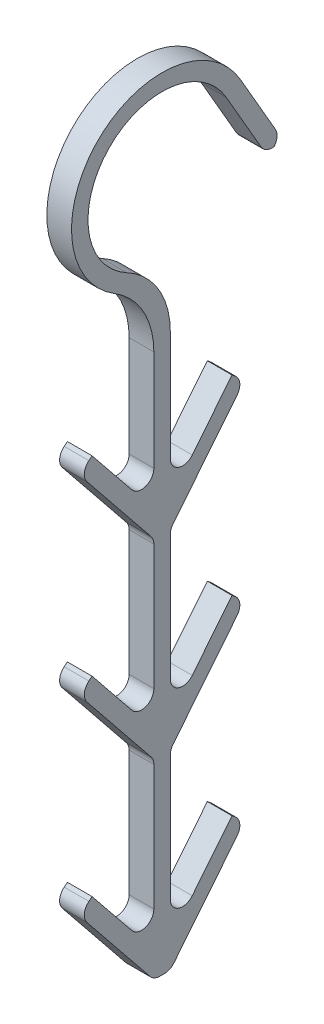
from build123d import *

# Parameters (mm, degrees)
SKETCH1_R           = 22
SKETCH1_R_2         = 18
BOSS_EXTRUDE1_DEPTH = 6
BOSS_EXTRUDE2_DEPTH = 6
CUT_EXTRUDE1_DEPTH  = 37.933063475
SKETCH4_W           = 4
SKETCH4_H           = 30
BOSS_EXTRUDE3_DEPTH = 6
CUT_EXTRUDE2_DEPTH  = 57.332617611
FILLET1_R           = 20
FILLET2_R           = 20
SKETCH6_W           = 4
SKETCH6_H           = 120
BOSS_EXTRUDE4_DEPTH = 6
BOSS_EXTRUDE5_DEPTH = 6
FILLET3_R           = 3


with BuildPart() as part:
    # Sketch1 → Boss-Extrude1 (new body)
    with BuildSketch(Plane(origin=(0, 0, 0), x_dir=(0, 0, -1), z_dir=(1, 0, 0))):
        Circle(SKETCH1_R)
        Circle(SKETCH1_R_2, mode=Mode.SUBTRACT)
    extrude(amount=BOSS_EXTRUDE1_DEPTH)

    # Sketch2 → Boss-Extrude2 (add)
    with BuildSketch(Plane(origin=(6, 0, 0), x_dir=(0, 0, -1), z_dir=(1, 0, 0))):
        Polygon((19.052558883, 11), (29.052558883, -6.320508076), (25.588457268, -8.320508076), (15.588457268, 9), align=None)
    extrude(amount=-BOSS_EXTRUDE2_DEPTH)

    # Sketch3 → Cut-Extrude1 (cut, through all)
    with BuildSketch(Plane(origin=(6, 0, 0), x_dir=(0, 0, -1), z_dir=(1, 0, 0))):
        with BuildLine():
            ThreePointArc((18, 0), (14.280360125, -10.957705722), (4.658742812, -17.386664873))
            Line((4.658742812, -17.386664873), (5.694018992, -21.250368178))
            ThreePointArc((5.694018992, -21.250368178), (16.84102585, -14.15555892), (21.913012588, -1.95445115))
            Line((21.913012588, -1.95445115), (15.588457268, 9))
            ThreePointArc((15.588457268, 9), (17.386664873, 4.658742812), (18, 0))
        make_face()
    extrude(amount=-CUT_EXTRUDE1_DEPTH, mode=Mode.SUBTRACT)

    # Sketch4 → Boss-Extrude3 (add)
    with BuildSketch(Plane(origin=(6, 0, 0), x_dir=(0, 0, -1), z_dir=(1, 0, 0))):
        with Locations((0, -32.88854382)):
            Rectangle(SKETCH4_W, SKETCH4_H)
    extrude(amount=-BOSS_EXTRUDE3_DEPTH)

    # Sketch5 → Cut-Extrude2 (cut, through all)
    with BuildSketch(Plane(origin=(6, 0, 0), x_dir=(0, 0, -1), z_dir=(1, 0, 0))):
        with BuildLine():
            Line((2, -21.9089023), (2, -17.88854382))
            Line((2, -17.88854382), (4.658742812, -17.386664873))
            Line((4.658742812, -17.386664873), (5.694018992, -21.250368178))
            ThreePointArc((5.694018992, -21.250368178), (3.876129227, -21.742981124), (2, -21.9089023))
        make_face()
    extrude(amount=-CUT_EXTRUDE2_DEPTH, mode=Mode.SUBTRACT)

    # Fillet1
    # the kernel refuses this fillet: 20 mm, written as the material it adds along each edge
    with BuildSketch(Plane(origin=(6, -21.9089023, 2), x_dir=(0, -1, 0), z_dir=(-1, 0, 0))) as fillet1_piece_1:
        with BuildLine():
            CenterArc((13.86818534, 20), FILLET1_R, 211.588135505, 58.411864495)
            ThreePointArc((-3.16852306, 9.523809524), (-1.033875129, 4.945015522), (0, 0))
            Line((0, 0), (13.86818534, 0))
        make_face()
    extrude(amount=6)
    # the kernel refuses this fillet: 20 mm, written as the material it takes off along each edge
    with BuildSketch(Plane(origin=(36, -17.88854382, -2), x_dir=(0, -1, 0), z_dir=(-1, 0, 0))) as fillet1_2_piece_1:
        with BuildLine():
            CenterArc((12, 20), FILLET1_R, 233.130102354, 36.869897646)
            Line((0, 4), (0, 0))
            Line((0, 0), (12, 0))
        make_face()
    extrude(amount=66, mode=Mode.SUBTRACT)

    # Fillet2
    fillet2_edges = [part.edges().sort_by_distance(p)[0] for p in [
        (3, -17.88854382, 2),
    ]]
    fillet(fillet2_edges, radius=FILLET2_R)

    # Sketch6 → Boss-Extrude4 (add)
    with BuildSketch(Plane.ZY):
        with Locations((0, -107.88854382)):
            Rectangle(SKETCH6_W, SKETCH6_H)
    extrude(amount=-BOSS_EXTRUDE4_DEPTH)

    # Sketch7 → Boss-Extrude5 (add)
    with BuildSketch(Plane(origin=(0, 0, -2), x_dir=(0, 0, -1), z_dir=(1, 0, 0))):
        Polygon((-4, -167.88854382), (-22.115183313, -145.397653808), (-19, -142.88854382), (-4, -161.511780713), align=None)
        Polygon((-4, -115.135017606), (-4, -121.511780713), (-22.115183313, -99.0208907), (-19, -96.511780713), align=None)
        Polygon((-4, -68.758254499), (-4, -75.135017606), (-22.115183313, -52.644127593), (-19, -50.135017606), align=None)
    boss_extrude5 = extrude(amount=BOSS_EXTRUDE5_DEPTH)

    # Mirror1: Boss-Extrude5 across plane
    add(boss_extrude5.mirror(Plane.XY))

    # Fillet3
    # the kernel refuses this fillet: 3 mm, written as the material it adds along each edge
    with BuildSketch(Plane(origin=(0, -161.511780713, 2), x_dir=(0, 1, 0), z_dir=(1, 0, 0)), Plane(origin=(0, -115.135017606, 2), x_dir=(0, 1, 0), z_dir=(1, 0, 0)), Plane(origin=(0, -68.758254499, 2), x_dir=(0, 1, 0), z_dir=(1, 0, 0))) as fillet3_piece_1:
        with BuildLine():
            CenterArc((FILLET3_R * 2.83573990297, FILLET3_R), FILLET3_R, 128.849545597, 141.150454403)
            Line((FILLET3_R * 2.20846240609, FILLET3_R * 1.77879582813), (0, 0))
            Line((0, 0), (FILLET3_R * 2.83573990297, 0))
        make_face()
    extrude(amount=6)
    with BuildSketch(Plane(origin=(0, -121.511780713, 2), x_dir=(0, 0.7787958281290415, 0.6272774968774191), z_dir=(1, 0, 0)), Plane(origin=(0, -75.135017606, 2), x_dir=(0, 0.7787958281290404, 0.6272774968774205), z_dir=(1, 0, 0)), Plane(origin=(0, -121.511780713, -2), x_dir=(0, -1, 0), z_dir=(1, 0, 0)), Plane(origin=(0, -75.135017606, -2), x_dir=(0, -1, 0), z_dir=(1, 0, 0))) as fillet3_piece_2:
        with BuildLine():
            CenterArc((FILLET3_R * 0.352641650581, FILLET3_R), FILLET3_R, 231.150454403, 38.849545597)
            Line((-FILLET3_R * 0.274635846297, FILLET3_R * 0.221204171871), (0, 0))
            Line((0, 0), (FILLET3_R * 0.352641650581, 0))
        make_face()
    extrude(amount=6)
    with BuildSketch(Plane(origin=(0, -161.511780713, -2), x_dir=(0, 1, 0), z_dir=(1, 0, 0)), Plane(origin=(0, -115.135017606, -2), x_dir=(0, 1, 0), z_dir=(1, 0, 0)), Plane(origin=(0, -68.758254499, -2), x_dir=(0, 1, 0), z_dir=(1, 0, 0))) as fillet3_piece_3:
        with BuildLine():
            CenterArc((FILLET3_R * 2.83573990297, -FILLET3_R), FILLET3_R, 90, 141.150454403)
            Line((FILLET3_R * 2.20846240609, -FILLET3_R * 1.77879582813), (0, 0))
            Line((0, 0), (FILLET3_R * 2.83573990297, 0))
        make_face()
    extrude(amount=6)
    # the kernel refuses this fillet: 3 mm, written as the material it takes off along each edge
    with BuildSketch(Plane(origin=(-3.589411592, -167.88854382, 2), x_dir=(0, 0.7787958281290398, 0.6272774968774211), z_dir=(1, 0, 0)), Plane(origin=(-3.589411592, -167.88854382, -2), x_dir=(0, 0, 1), z_dir=(1, 0, 0))) as fillet3_2_piece_1:
        with BuildLine():
            CenterArc((FILLET3_R * 0.478588212289, -FILLET3_R), FILLET3_R, 90, 51.150454403)
            Line((-FILLET3_R * 0.30020761584, -FILLET3_R * 0.372722503123), (0, 0))
            Line((0, 0), (FILLET3_R * 0.478588212289, 0))
        make_face()
    extrude(amount=13.178823184, mode=Mode.SUBTRACT)
    with BuildSketch(Plane(origin=(-7.5, -145.397653808, 20.115183313), x_dir=(0, 0.6272774968774232, -0.7787958281290382), z_dir=(1, 0, 0)), Plane(origin=(-7.5, -99.0208907, 20.115183313), x_dir=(0, 0.6272774968774221, -0.7787958281290391), z_dir=(1, 0, 0)), Plane(origin=(-7.5, -52.644127593, 20.115183313), x_dir=(0, 0.6272774968774235, -0.778795828129038), z_dir=(1, 0, 0)), Plane(origin=(-7.5, -145.397653808, -20.115183313), x_dir=(0, -0.7787958281290382, 0.627277496877423), z_dir=(1, 0, 0)), Plane(origin=(-7.5, -99.0208907, -20.115183313), x_dir=(0, -0.7787958281290382, 0.627277496877423), z_dir=(1, 0, 0)), Plane(origin=(-7.5, -52.644127593, -20.115183313), x_dir=(0, -0.7787958281290385, 0.6272774968774228), z_dir=(1, 0, 0))) as fillet3_2_piece_2:
        with BuildLine():
            CenterArc((FILLET3_R, -FILLET3_R), FILLET3_R, 90, 90)
            Line((0, -FILLET3_R), (0, 0))
            Line((0, 0), (FILLET3_R, 0))
        make_face()
    extrude(amount=21, mode=Mode.SUBTRACT)
    with BuildSketch(Plane(origin=(13.5, -8.320508076, -25.588457268), x_dir=(0, 0.8660254037844379, 0.5000000000000012), z_dir=(-1, 0, 0)), Plane(origin=(13.5, -6.320508076, -29.052558883), x_dir=(0, -0.5000000000000019, 0.8660254037844376), z_dir=(-1, 0, 0))) as fillet3_2_piece_3:
        with BuildLine():
            CenterArc((FILLET3_R, FILLET3_R), FILLET3_R, 180, 90)
            Line((0, FILLET3_R), (0, 0))
            Line((0, 0), (FILLET3_R, 0))
        make_face()
    extrude(amount=21, mode=Mode.SUBTRACT)


solid = part.part
